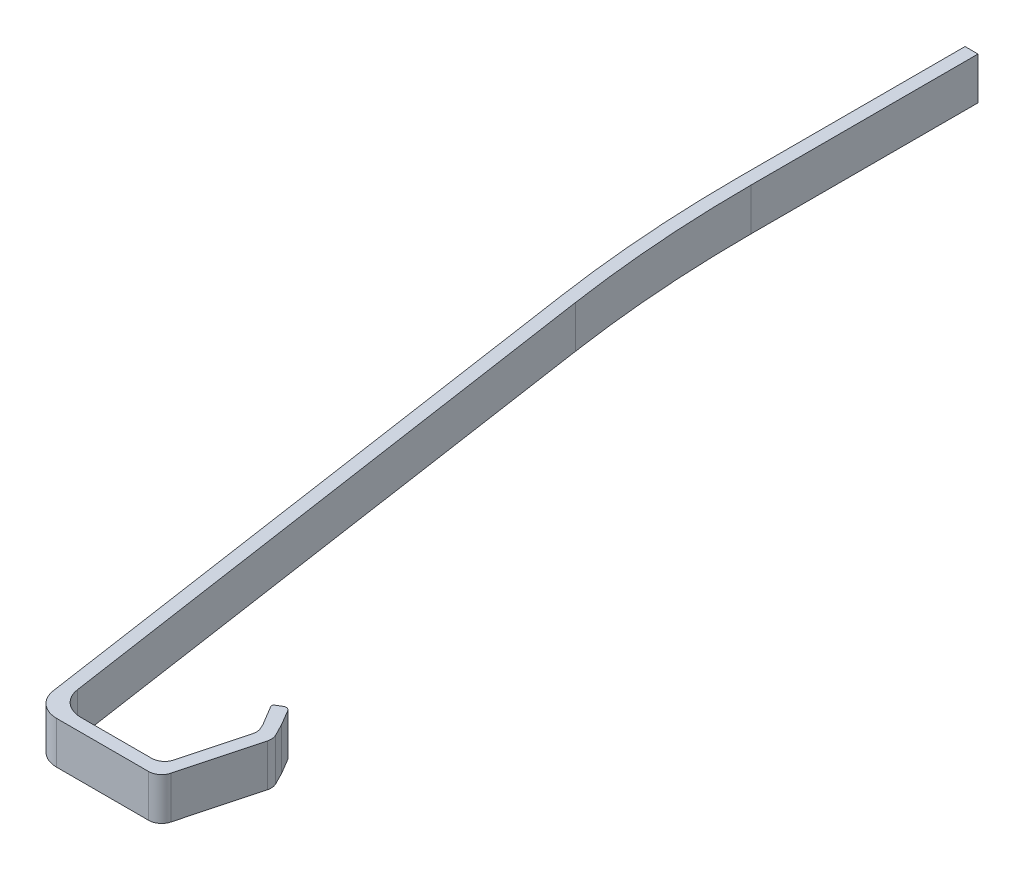
from build123d import *

# Parameters (mm, degrees)
BOSS_EXTRUDE1_DEPTH      = 4.9
BOSS_EXTRUDE1_DEPTH_BACK = 4.9


with BuildPart() as part:
    # Sketch1 → Boss-Extrude1 (new, two sides: drawn at the far end of the back side and taken through both)
    with BuildSketch(Plane(origin=(0, 0, 0), x_dir=(1, 0, 0), z_dir=(0, 1, 0)).offset(-BOSS_EXTRUDE1_DEPTH_BACK)):
        with BuildLine():
            Line((14.139704236, -107.57296828), (14.139704236, -55))
            Line((14.139704236, -55), (11.139704236, -55))
            Line((11.139704236, -55), (11.139704236, -107.57296828))
            ThreePointArc((11.139704236, -107.57296828), (11.954116062, -129.773650702), (14.392973543, -151.854989901))
            Line((14.392973543, -151.854989901), (34.78314741, -289.876871715))
            ThreePointArc((34.78314741, -289.876871715), (36.798345533, -293.542093696), (40.718726235, -295))
            Line((40.718726235, -295), (62.036020432, -295))
            ThreePointArc((62.036020432, -295), (63.863676368, -294.379006889), (64.934691141, -292.773115853))
            Line((64.934691141, -292.773115853), (69.645825561, -275.109492351))
            ThreePointArc((69.645825561, -275.109492351), (69.730627927, -274.02191122), (69.420940845, -272.975910231))
            Line((69.420940845, -272.975910231), (67.998466185, -270.180256335))
            Line((67.998466185, -270.180256335), (67.934740393, -270.07233274))
            Line((67.934740393, -270.07233274), (65.932760352, -266.681854911))
            ThreePointArc((65.932760352, -266.681854911), (65.317615772, -266.221021537), (64.557173026, -266.332811892))
            Line((64.557173026, -266.332811892), (63.276988126, -267.100922833))
            ThreePointArc((63.276988126, -267.100922833), (63.049164753, -267.408401483), (63.10548954, -267.786917173))
            Line((63.10548954, -267.786917173), (65.42072044, -271.645635339))
            Line((65.42072044, -271.645635339), (65.805438483, -272.286832078))
            ThreePointArc((65.805438483, -272.286832078), (65.89276832, -272.442724972), (65.970662013, -272.603540604))
            Line((65.970662013, -272.603540604), (66.311869933, -273.364986559))
            ThreePointArc((66.311869933, -273.364986559), (66.564497004, -274.351078344), (66.472838335, -275.364881152))
            Line((66.472838335, -275.364881152), (62.629961452, -289.773115853))
            ThreePointArc((62.629961452, -289.773115853), (61.558946679, -291.379006889), (59.731290743, -292))
            Line((59.731290743, -292), (43.308092042, -292))
            ThreePointArc((43.308092042, -292), (39.387711339, -290.542093696), (37.372513216, -286.876871715))
            Line((37.372513216, -286.876871715), (17.360762956, -151.416554044))
            ThreePointArc((17.360762956, -151.416554044), (14.946052579, -129.553841965), (14.139704236, -107.57296828))
        make_face()
    extrude(amount=BOSS_EXTRUDE1_DEPTH + BOSS_EXTRUDE1_DEPTH_BACK)


solid = part.part
